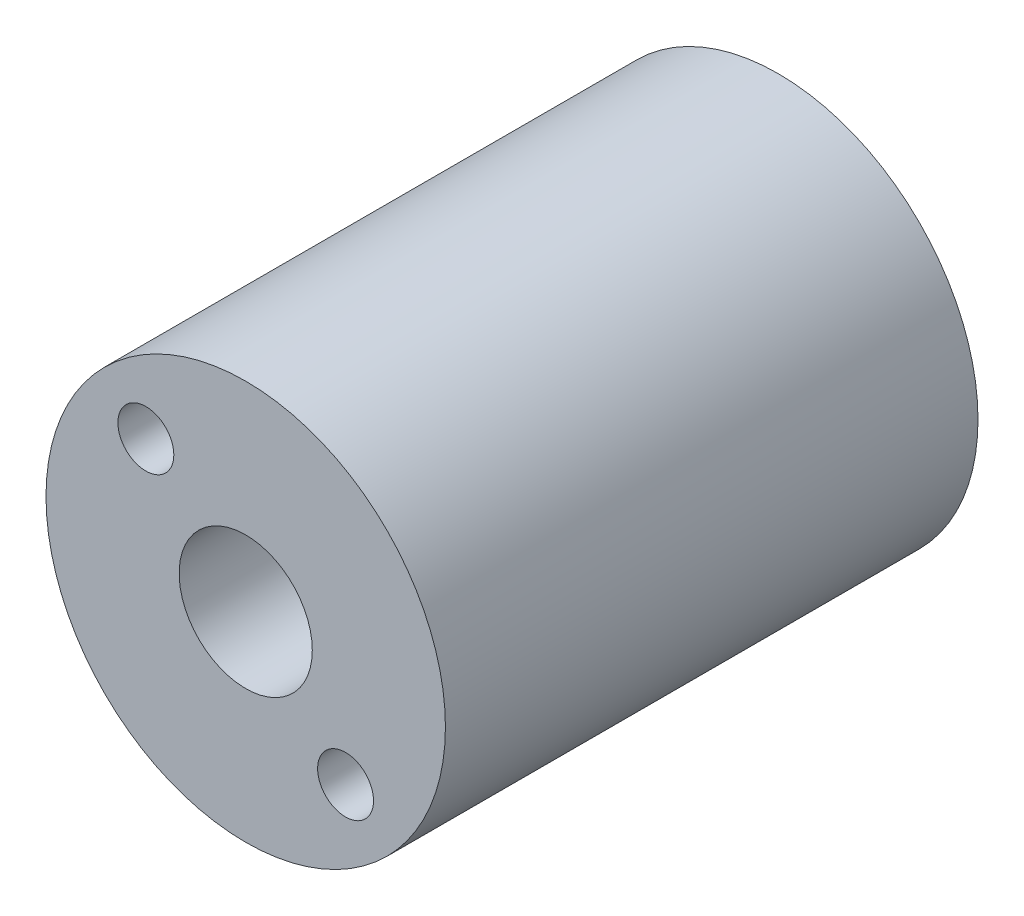
from build123d import *

# Parameters (mm, degrees)
SKIZZE1_R                       = 15
AUFSATZ_LINEAR_AUSTRAGEN1_DEPTH = 40
SKIZZE2_R                       = 5
SCHNITT_LINEAR_AUSTRAGEN1_DEPTH = 46.276925691
M5_GEWINDEBOHRUNG1_D            = 4.2


with BuildPart() as part:
    # Skizze1 → Aufsatz-Linear austragen1 (new body)
    with BuildSketch(Plane.XY):
        Circle(SKIZZE1_R)
    extrude(amount=AUFSATZ_LINEAR_AUSTRAGEN1_DEPTH)

    # Skizze2 → Schnitt-Linear austragen1 (cut, through all)
    with BuildSketch(Plane.XY.offset(40)):
        Circle(SKIZZE2_R)
    extrude(amount=-SCHNITT_LINEAR_AUSTRAGEN1_DEPTH, mode=Mode.SUBTRACT)

    # M5 Gewindebohrung1 (through all)
    with Locations(Plane.XY.offset(40)):
        with Locations((-7.5, 7.5), (7.5, -7.5)):
            Hole(M5_GEWINDEBOHRUNG1_D / 2)


solid = part.part
